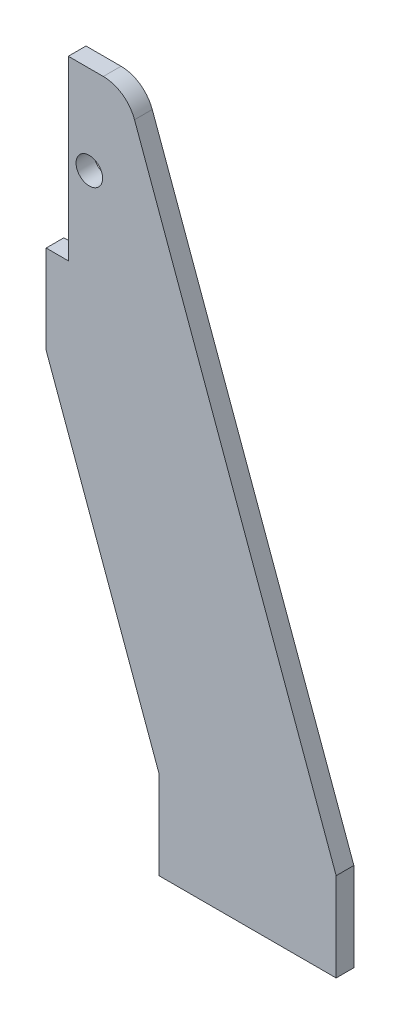
from build123d import *

# Parameters (mm, degrees)
SALIENTE_EXTRUIR1_DEPTH                        = 8
CROQUIS2_R                                     = 6
CORTAR_EXTRUIR1_DEPTH                          = 311.586541885
PERFORADOR_PARA_ROSCAR_PARA_MACHO_DE_ROS_D     = 3.3
PERFORADOR_PARA_ROSCAR_PARA_MACHO_DE_ROS_DEPTH = 10
PERFORADOR_PARA_ROSCAR_PARA_MACHO_DE_ROS_TIP   = 0.991420021
TALADROS_DE_ESPIGA_DE_4_0MM3_D                 = 4
TALADROS_DE_ESPIGA_DE_4_0MM3_DEPTH             = 10
TALADROS_DE_ESPIGA_DE_4_0MM3_TIP               = 1.201721238
PERFORADOR_PARA_ROSCAR_PARA_MACHO_DE_2_D       = 3.3
PERFORADOR_PARA_ROSCAR_PARA_MACHO_DE_2_DEPTH   = 7
PERFORADOR_PARA_ROSCAR_PARA_MACHO_DE_2_TIP     = 0.991420021


with BuildPart() as part:
    # Croquis1 → Saliente-Extruir1 (new body)
    with BuildSketch(Plane.XY):
        with BuildLine():
            Line((80, 0), (80, 40))
            Line((80, 40), (-11.039984671, 290.13030215))
            ThreePointArc((-11.039984671, 290.13030215), (-16.531727437, 297.287280664), (-25.135373982, 300))
            Line((-25.135373982, 300), (-40.955832797, 300))
            Line((-40.955832797, 300), (-40.955832797, 220))
            Line((-40.955832797, 220), (-50.955832797, 220))
            Line((-50.955832797, 220), (-50.955832797, 180))
            Line((-50.955832797, 180), (0, 40))
            Line((0, 40), (0, 0))
            Line((0, 0), (80, 0))
        make_face()
    extrude(amount=SALIENTE_EXTRUIR1_DEPTH)

    # Croquis2 → Cortar-Extruir1 (cut, through all)
    with BuildSketch(Plane(origin=(0, 0, 0), x_dir=(-1, 0, 0), z_dir=(0, 0, -1))):
        with Locations((31.455832797, 260)):
            Circle(CROQUIS2_R)
    extrude(amount=-CORTAR_EXTRUIR1_DEPTH, mode=Mode.SUBTRACT)

    # Perforador para roscar para macho de ros
    with Locations(Plane.ZY.offset(40.955832797)):
        with Locations((5, 232), (5, 288)):
            Hole(PERFORADOR_PARA_ROSCAR_PARA_MACHO_DE_ROS_D / 2, depth=PERFORADOR_PARA_ROSCAR_PARA_MACHO_DE_ROS_DEPTH)
            with Locations((0, 0, -(PERFORADOR_PARA_ROSCAR_PARA_MACHO_DE_ROS_DEPTH + PERFORADOR_PARA_ROSCAR_PARA_MACHO_DE_ROS_TIP / 2))):  # 118° drill point
                Cone(0, PERFORADOR_PARA_ROSCAR_PARA_MACHO_DE_ROS_D / 2, PERFORADOR_PARA_ROSCAR_PARA_MACHO_DE_ROS_TIP, mode=Mode.SUBTRACT)

    # Taladros de espiga de Ø4.0mm3
    with Locations(Plane.ZY.offset(40.955832797)):
        with Locations((4, 246), (4, 274)):
            Hole(TALADROS_DE_ESPIGA_DE_4_0MM3_D / 2, depth=TALADROS_DE_ESPIGA_DE_4_0MM3_DEPTH)
            with Locations((0, 0, -(TALADROS_DE_ESPIGA_DE_4_0MM3_DEPTH + TALADROS_DE_ESPIGA_DE_4_0MM3_TIP / 2))):  # 118° drill point
                Cone(0, TALADROS_DE_ESPIGA_DE_4_0MM3_D / 2, TALADROS_DE_ESPIGA_DE_4_0MM3_TIP, mode=Mode.SUBTRACT)

    # Perforador para roscar para macho de 2
    with Locations(Plane(origin=(0, 0, 0), x_dir=(-1, 0, 0), z_dir=(0, 0, -1))):
        with Locations((31.455832797, 241.75), (31.455832797, 278.25)):
            Hole(PERFORADOR_PARA_ROSCAR_PARA_MACHO_DE_2_D / 2, depth=PERFORADOR_PARA_ROSCAR_PARA_MACHO_DE_2_DEPTH)
            with Locations((0, 0, -(PERFORADOR_PARA_ROSCAR_PARA_MACHO_DE_2_DEPTH + PERFORADOR_PARA_ROSCAR_PARA_MACHO_DE_2_TIP / 2))):  # 118° drill point
                Cone(0, PERFORADOR_PARA_ROSCAR_PARA_MACHO_DE_2_D / 2, PERFORADOR_PARA_ROSCAR_PARA_MACHO_DE_2_TIP, mode=Mode.SUBTRACT)


solid = part.part
